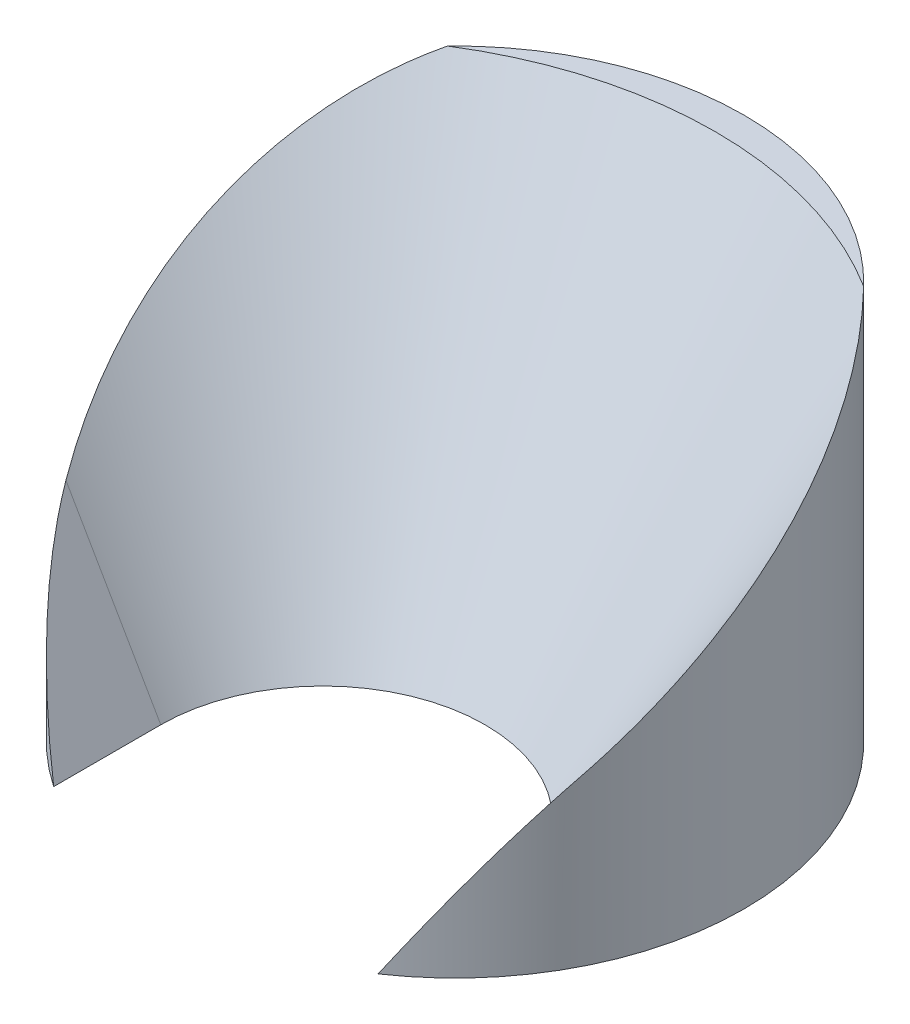
from build123d import *

# Parameters (mm, degrees)
BOSS_EXTRUDE1_DEPTH = 25.4
CHAMFER1_SIZE       = 15
CHAMFER1_SIZE_2     = 25.980762114


with BuildPart() as part:
    # Sketch1 → Boss-Extrude1 (new body)
    with BuildSketch(Plane(origin=(0, 0, 0), x_dir=(1, 0, 0), z_dir=(0, 1, 0))):
        with BuildLine():
            ThreePointArc((-10, -8.415), (0, 1.585), (10, -8.415))
            Line((10, -8.415), (10, -15.463254024))
            ThreePointArc((10, -15.463254024), (16.17501507, -8.802335628), (18.415, 0))
            ThreePointArc((18.415, 0), (-8.802335628, 16.17501507), (-10, -15.463254024))
            Line((-10, -15.463254024), (-10, -8.415))
        make_face()
    extrude(amount=BOSS_EXTRUDE1_DEPTH)

    # Chamfer1
    # the kernel refuses this chamfer: 25.980762114, 15 mm, written as the material it takes off along each edge
    with BuildSketch(Plane(origin=(0, 25.4, 8.415), x_dir=(-1, 0, 0), z_dir=(0, 0, 1))) as chamfer1_piece_1:
        Polygon((10 + CHAMFER1_SIZE, 0), (10, CHAMFER1_SIZE_2), (10, 0), align=None)
    revolve(axis=Axis((0, 25.4, 8.415), (0, -1, 0)), revolution_arc=180, mode=Mode.SUBTRACT)
    with BuildSketch(Plane(origin=(-10, 25.4, 82.677713582), x_dir=(0.019326765612700622, -0.9998132206222078, 0), z_dir=(0, 0, -1))) as chamfer1_piece_2:
        Polygon((CHAMFER1_SIZE_2 * 0.999813220604, CHAMFER1_SIZE_2 * 0.0193267656124), (-CHAMFER1_SIZE * 0.0193267656127, CHAMFER1_SIZE * 0.999813220622), (0, 0), align=None)
    extrude(amount=74.262713582, mode=Mode.SUBTRACT)
    with BuildSketch(Plane(origin=(10, 25.4, 8.415), x_dir=(0.9983227437537926, 0.05789386240267136, 0), z_dir=(0, 0, 1))) as chamfer1_piece_3:
        Polygon((CHAMFER1_SIZE * 0.998322743754, -CHAMFER1_SIZE * 0.0578938624027), (-CHAMFER1_SIZE_2 * 0.0578938624016, -CHAMFER1_SIZE_2 * 0.998322743736), (0, 0), align=None)
    extrude(amount=74.262713582, mode=Mode.SUBTRACT)


solid = part.part
